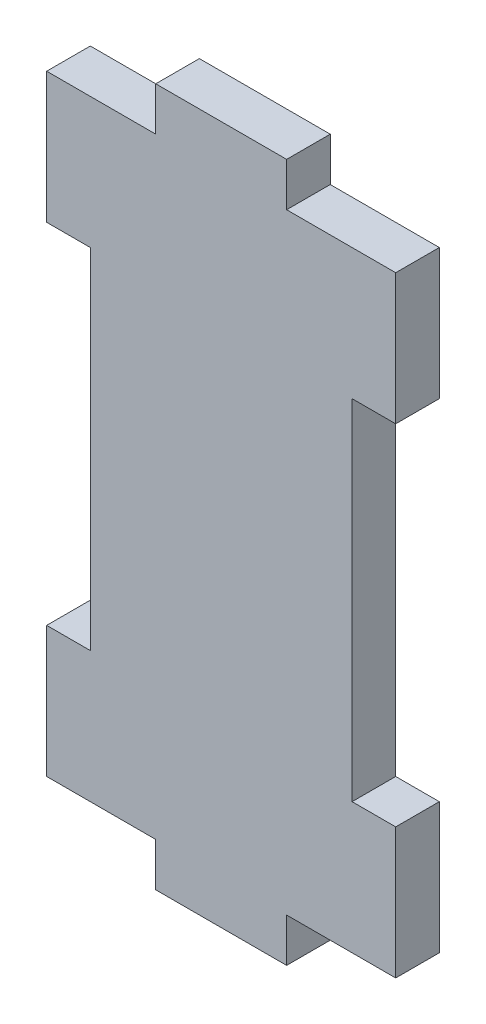
from build123d import *

# Parameters (mm, degrees)
BOSS_EXTRUDE2_DEPTH = 5
SKETCH3_W           = 5
SKETCH3_H           = 40
CUT_EXTRUDE1_DEPTH  = 5


with BuildPart() as part:
    # Sketch2 → Boss-Extrude2 (new body)
    with BuildSketch(Plane.XY):
        Polygon((-7.5, 40), (7.5, 40), (7.5, 35), (20, 35), (20, -35), (7.5, -35), (7.5, -40), (-7.5, -40), (-7.5, -35), (-20, -35), (-20, 35), (-7.5, 35), align=None)
    extrude(amount=BOSS_EXTRUDE2_DEPTH)

    # Sketch3 → Cut-Extrude1 (cut)
    with BuildSketch(Plane.XY.offset(5)):
        with Locations((-17.5, 0)):
            Rectangle(SKETCH3_W, SKETCH3_H)
    cut_extrude1 = extrude(amount=-CUT_EXTRUDE1_DEPTH, mode=Mode.SUBTRACT)

    # Mirror1: Cut-Extrude1 across plane
    add(cut_extrude1.mirror(Plane(origin=(0, 0, 0), x_dir=(0, 0, 1), z_dir=(1, 0, 0))), mode=Mode.SUBTRACT)


solid = part.part
